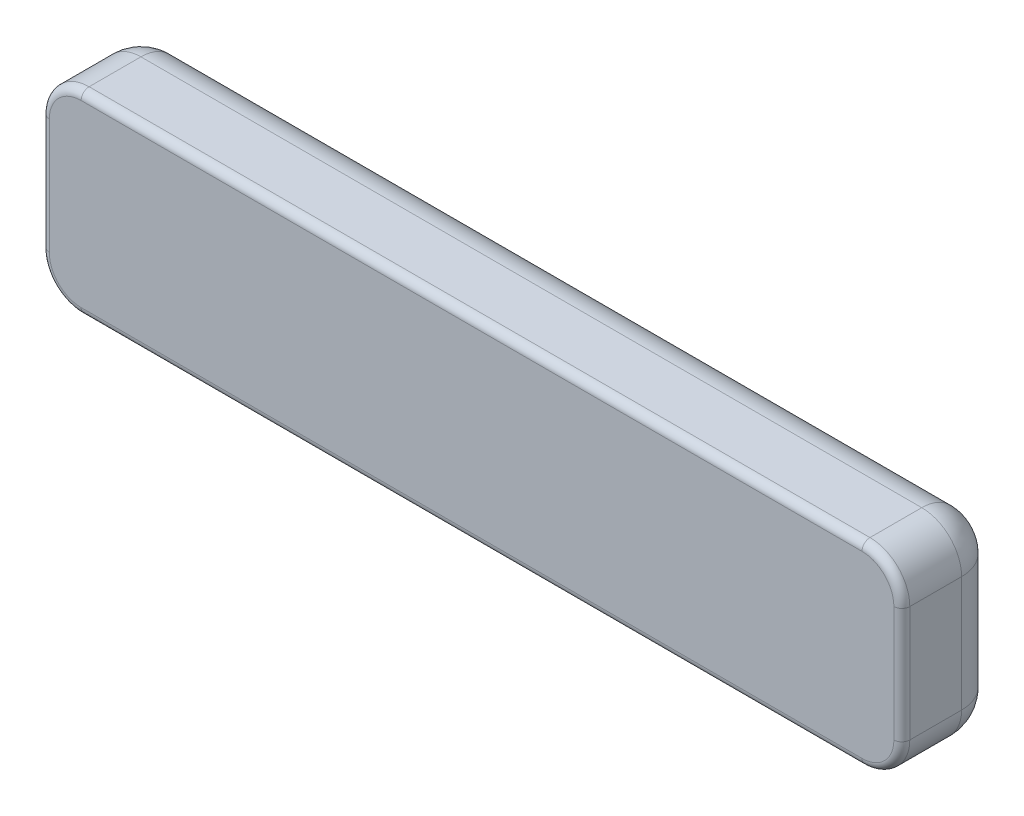
from build123d import *

# Parameters (mm, degrees)
SKETCH1_W           = 108
SKETCH1_H           = 24.5
BOSS_EXTRUDE1_DEPTH = 12.5
FILLET1_R           = 5
SKETCH2_R           = 1.8
CUT_EXTRUDE1_DEPTH  = 5
FILLET2_R           = 5
FILLET3_R           = 1


with BuildPart() as part:
    # Sketch1 → Boss-Extrude1 (new body)
    with BuildSketch(Plane.XY):
        Rectangle(SKETCH1_W, SKETCH1_H)
    extrude(amount=BOSS_EXTRUDE1_DEPTH)

    # Fillet1
    fillet1_edges = [part.edges().sort_by_distance(p)[0] for p in [
        (0, -12.25, 0),
        (-54, 0, 0),
        (0, 12.25, 0),
        (54, 0, 0),
    ]]
    fillet(fillet1_edges, radius=FILLET1_R)

    # Sketch2 → Cut-Extrude1 (cut)
    with BuildSketch(Plane(origin=(0, 0, 0), x_dir=(-1, 0, 0), z_dir=(0, 0, -1))):
        with Locations((-25, 0)):
            Circle(SKETCH2_R)
        with Locations((25, 0)):
            Circle(SKETCH2_R)
    extrude(amount=-CUT_EXTRUDE1_DEPTH, mode=Mode.SUBTRACT)

    # Fillet2
    # the kernel refuses this fillet: 5 mm, written as the material it takes off along each edge
    with BuildSketch(Plane(origin=(49, 7.25, 5), x_dir=(0, 1, 0), z_dir=(1, 0, 0))) as fillet2_piece_1_section:
        Polygon((0, 0), (FILLET2_R, 0), (FILLET2_R, -FILLET2_R), (0, -FILLET2_R), align=None)
    fillet2_piece_1 = extrude(amount=FILLET2_R, mode=Mode.PRIVATE)
    fillet2_piece_1 = fillet2_piece_1 - Plane(origin=(49, 7.25, 5), x_dir=(0, -0.7071067811865475, 0.7071067811865475), z_dir=(1, 0, 0)) * Sphere(FILLET2_R, mode=Mode.PRIVATE)
    add(fillet2_piece_1, mode=Mode.SUBTRACT)
    with BuildSketch(Plane(origin=(49, -7.25, 5), x_dir=(1, 0, 0), z_dir=(0, -1, 0))) as fillet2_piece_2_section:
        Polygon((0, 0), (FILLET2_R, 0), (FILLET2_R, -FILLET2_R), (0, -FILLET2_R), align=None)
    fillet2_piece_2 = extrude(amount=FILLET2_R, mode=Mode.PRIVATE)
    fillet2_piece_2 = fillet2_piece_2 - Plane(origin=(49, -7.25, 5), x_dir=(-0.7071067811865475, 0, 0.7071067811865475), z_dir=(0, -1, 0)) * Sphere(FILLET2_R, mode=Mode.PRIVATE)
    add(fillet2_piece_2, mode=Mode.SUBTRACT)
    with BuildSketch(Plane(origin=(-49, 7.25, 5), x_dir=(0, 1, 0), z_dir=(-1, 0, 0))) as fillet2_piece_3_section:
        Polygon((0, 0), (FILLET2_R, 0), (FILLET2_R, FILLET2_R), (0, FILLET2_R), align=None)
    fillet2_piece_3 = extrude(amount=FILLET2_R, mode=Mode.PRIVATE)
    fillet2_piece_3 = fillet2_piece_3 - Plane(origin=(-49, 7.25, 5), x_dir=(0, -0.7071067811865475, 0.7071067811865475), z_dir=(-1, 0, 0)) * Sphere(FILLET2_R, mode=Mode.PRIVATE)
    add(fillet2_piece_3, mode=Mode.SUBTRACT)
    with BuildSketch(Plane(origin=(-49, -7.25, 5), x_dir=(-1, 0, 0), z_dir=(0, -1, 0))) as fillet2_piece_4_section:
        Polygon((0, 0), (FILLET2_R, 0), (FILLET2_R, FILLET2_R), (0, FILLET2_R), align=None)
    fillet2_piece_4 = extrude(amount=FILLET2_R, mode=Mode.PRIVATE)
    fillet2_piece_4 = fillet2_piece_4 - Plane(origin=(-49, -7.25, 5), x_dir=(0.7071067811865475, 0, 0.7071067811865475), z_dir=(0, -1, 0)) * Sphere(FILLET2_R, mode=Mode.PRIVATE)
    add(fillet2_piece_4, mode=Mode.SUBTRACT)
    with BuildSketch(Plane(origin=(54, -12.25, 5), x_dir=(-1, 0, 0), z_dir=(0, 0, 1)), Plane(origin=(54, 12.25, 5), x_dir=(0, -1, 0), z_dir=(0, 0, 1))) as fillet2_piece_5:
        with BuildLine():
            CenterArc((FILLET2_R, -FILLET2_R), FILLET2_R, 90, 90)
            Line((0, -FILLET2_R), (0, 0))
            Line((0, 0), (FILLET2_R, 0))
        make_face()
    extrude(amount=20, mode=Mode.SUBTRACT)
    with BuildSketch(Plane(origin=(-54, -12.25, 5), x_dir=(1, 0, 0), z_dir=(0, 0, 1)), Plane(origin=(-54, 12.25, 5), x_dir=(0, -1, 0), z_dir=(0, 0, 1))) as fillet2_piece_6:
        with BuildLine():
            CenterArc((FILLET2_R, FILLET2_R), FILLET2_R, 180, 90)
            Line((0, FILLET2_R), (0, 0))
            Line((0, 0), (FILLET2_R, 0))
        make_face()
    extrude(amount=20, mode=Mode.SUBTRACT)

    # Fillet3
    fillet3_edges = [part.edges().sort_by_distance(p)[0] for p in [
        (0, -12.25, 12.5),
        (-54, 0, 12.5),
        (54, 0, 12.5),
        (0, 12.25, 12.5),
        (52.535533906, 10.785533906, 12.5),
        (52.535533906, -10.785533906, 12.5),
        (-52.535533906, 10.785533906, 12.5),
        (-52.535533906, -10.785533906, 12.5),
    ]]
    fillet(fillet3_edges, radius=FILLET3_R)


solid = part.part
